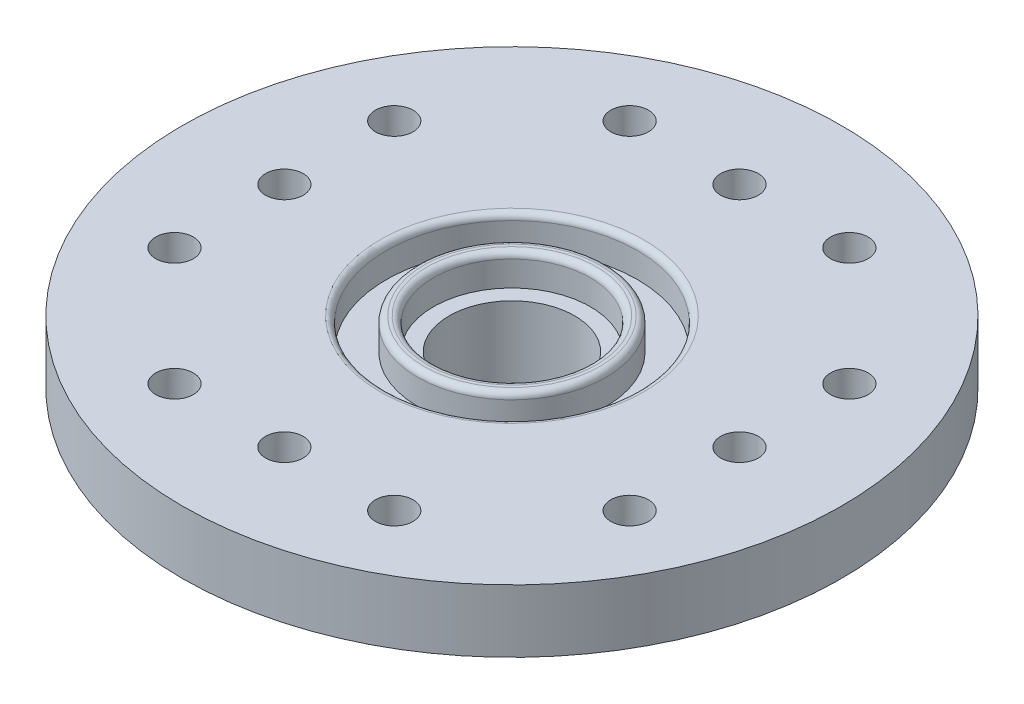
from build123d import *

# Parameters (mm, degrees)
CROQUIS1_R              = 10.5
SALIENTE_EXTRUIR1_DEPTH = 2
CROQUIS2_R              = 4
CROQUIS2_R_2            = 2
SALIENTE_EXTRUIR2_DEPTH = 3
REDONDEO1_R             = 1
CROQUIS3_R              = 4
CROQUIS3_R_2            = 3
CORTAR_EXTRUIR1_DEPTH   = 1
CROQUIS4_R              = 2
CORTAR_EXTRUIR2_DEPTH   = 3
CROQUIS5_R              = 2.5
CORTAR_EXTRUIR3_DEPTH   = 1
CROQUIS6_R              = 0.6
CORTAR_EXTRUIR4_DEPTH   = 16.668439616
MATRIZC1_COUNT          = 4
REDONDEO2_R             = 0.2


with BuildPart() as part:
    # Croquis1 → Saliente-Extruir1 (new body)
    with BuildSketch(Plane(origin=(0, 0, 0), x_dir=(1, 0, 0), z_dir=(0, 1, 0))):
        Circle(CROQUIS1_R)
    extrude(amount=SALIENTE_EXTRUIR1_DEPTH)

    # Croquis2 → Saliente-Extruir2 (add)
    with BuildSketch(Plane.XZ):
        Circle(CROQUIS2_R)
        Circle(CROQUIS2_R_2, mode=Mode.SUBTRACT)
    extrude(amount=SALIENTE_EXTRUIR2_DEPTH)

    # Redondeo1
    redondeo1_edges = [part.edges().sort_by_distance(p)[0] for p in [
        (-4, -3, 0),
    ]]
    fillet(redondeo1_edges, radius=REDONDEO1_R)

    # Croquis3 → Cortar-Extruir1 (cut)
    with BuildSketch(Plane(origin=(0, 2, 0), x_dir=(1, 0, 0), z_dir=(0, 1, 0))):
        Circle(CROQUIS3_R)
        Circle(CROQUIS3_R_2, mode=Mode.SUBTRACT)
    extrude(amount=-CORTAR_EXTRUIR1_DEPTH, mode=Mode.SUBTRACT)

    # Croquis4 → Cortar-Extruir2 (cut)
    with BuildSketch(Plane(origin=(0, 2, 0), x_dir=(1, 0, 0), z_dir=(0, 1, 0))):
        Circle(CROQUIS4_R)
    extrude(amount=-CORTAR_EXTRUIR2_DEPTH, mode=Mode.SUBTRACT)

    # Croquis5 → Cortar-Extruir3 (cut)
    with BuildSketch(Plane(origin=(0, 2, 0), x_dir=(1, 0, 0), z_dir=(0, 1, 0))):
        Circle(CROQUIS5_R)
    extrude(amount=-CORTAR_EXTRUIR3_DEPTH, mode=Mode.SUBTRACT)

    # Croquis6 → Cortar-Extruir4 (cut, through all)
    with BuildSketch(Plane(origin=(0, 2, 0), x_dir=(1, 0, 0), z_dir=(0, 1, 0))):
        with Locations((0, 7.25)):
            Circle(CROQUIS6_R)
        with Locations((3.5, 7.25)):
            Circle(CROQUIS6_R)
        with Locations((-3.5, 7.25)):
            Circle(CROQUIS6_R)
    cortar_extruir4 = extrude(amount=-CORTAR_EXTRUIR4_DEPTH, mode=Mode.SUBTRACT)

    # MatrizC1: Cortar-Extruir4 ×4 about axis
    matrizc1_axis = Axis((0, 2, 0), (0, 1, 0))
    for i in range(1, MATRIZC1_COUNT):
        add(cortar_extruir4.rotate(matrizc1_axis, i * 360 / MATRIZC1_COUNT), mode=Mode.SUBTRACT)

    # Redondeo2
    redondeo2_edges = [part.edges().sort_by_distance(p)[0] for p in [
        (-2.5, 2, 0),
        (-3, 2, 0),
        (-4, 2, 0),
    ]]
    fillet(redondeo2_edges, radius=REDONDEO2_R)


solid = part.part
